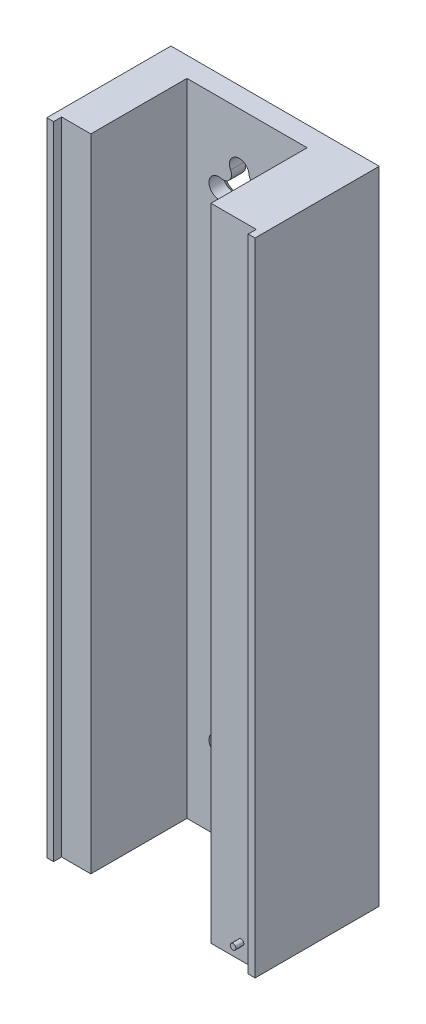
from build123d import *

# Parameters (mm, degrees)
PROFILE_EXTRUDE_DEPTH          = 80
SPROCKET_SKETCH_R              = 0.35
SPROCKET_EXTRUDE_DEPTH         = 1
MAGNET_CUT_DEPTH               = 85.817451035
MAGNET_CHAMFER_SIZE            = 0.75
MAGNET_CHAMFER_OF_MIRROR2_SIZE = 0.75


with BuildPart() as part:
    # Profile Sketch → Profile Extrude (new body)
    with BuildSketch(Plane(origin=(0.045617437, 0, -0.024209872), x_dir=(-1, 0, 0), z_dir=(0, 1, 0))):
        Polygon((5.545617437, -11.975790128), (5.545617437, 0.024209872), (-0.104382563, 0.024209872), (-0.104382563, 1.024209872), (-0.954382563, 1.024209872), (-0.954382563, -14.475790128), (25.045617437, -14.475790128), (25.045617437, 1.024209872), (24.195617437, 1.024209872), (24.195617437, 0.024209872), (20.545617437, 0.024209872), (20.545617437, -11.975790128), align=None)
    extrude(amount=PROFILE_EXTRUDE_DEPTH)

    # Sprocket Sketch → Sprocket Extrude (add)
    with BuildSketch(Plane.XY):
        with Locations((-1.75, 2)):
            Circle(SPROCKET_SKETCH_R)
    extrude(amount=SPROCKET_EXTRUDE_DEPTH)

    # Magnet Hole Sketch → Magnet Cut (cut, through all)
    with BuildSketch(Plane.XY.offset(-12)):
        with BuildLine():
            ThreePointArc((-11.151039281, 12.971757773), (-12.244559557, 12.644203044), (-13, 13.5))
            ThreePointArc((-13, 13.5), (-14.628920776, 14.461963369), (-15.254949311, 12.676789795))
            ThreePointArc((-15.254949311, 12.676789795), (-15.2813426, 11.535570233), (-16.328697807, 11.08155948))
            ThreePointArc((-16.328697807, 11.08155948), (-17.74694354, 9.829626791), (-16.242596036, 8.682589301))
            ThreePointArc((-16.242596036, 8.682589301), (-15.16538771, 8.304831552), (-15.057248383, 7.16844052))
            ThreePointArc((-15.057248383, 7.16844052), (-14.304851675, 5.432740197), (-12.749085251, 6.509005616))
            ThreePointArc((-12.749085251, 6.509005616), (-12.056940604, 7.41675805), (-10.942751617, 7.16844052))
            ThreePointArc((-10.942751617, 7.16844052), (-9.059499145, 7.347651415), (-9.602330121, 9.159857515))
            ThreePointArc((-9.602330121, 9.159857515), (-10.25176953, 10.098637121), (-9.671302193, 11.08155948))
            ThreePointArc((-9.671302193, 11.08155948), (-9.259784865, 12.928018228), (-11.151039281, 12.971757773))
        make_face()
    magnet_cut = extrude(amount=-MAGNET_CUT_DEPTH, mode=Mode.SUBTRACT)

    # Magnet Chamfer
    magnet_chamfer_edges = [part.edges().sort_by_distance(p)[0] for p in [
        (-14.628920776, 14.461963369, -14.5),
        (-15.2813426, 11.535570233, -14.5),
        (-12.244559557, 12.644203044, -14.5),
        (-17.74694354, 9.829626791, -14.5),
        (-9.259784865, 12.928018228, -14.5),
        (-15.16538771, 8.304831552, -14.5),
        (-10.25176953, 10.098637121, -14.5),
        (-14.304851675, 5.432740197, -14.5),
        (-9.059499145, 7.347651415, -14.5),
        (-12.056940604, 7.41675805, -14.5),
    ]]
    chamfer(magnet_chamfer_edges, length=MAGNET_CHAMFER_SIZE)

    # Mirror2: Magnet Cut across plane
    add(magnet_cut.mirror(Plane(origin=(0, 40, 0), x_dir=(0, 0, 1), z_dir=(0, -1, 0))), mode=Mode.SUBTRACT)

    # Magnet Chamfer of Mirror2
    magnet_chamfer_of_mirror2_edges = [part.edges().sort_by_distance(p)[0] for p in [
        (-14.628920776, 65.538036631, -14.5),
        (-15.2813426, 68.464429767, -14.5),
        (-12.244559557, 67.355796956, -14.5),
        (-17.74694354, 70.170373209, -14.5),
        (-9.259784865, 67.071981772, -14.5),
        (-15.16538771, 71.695168448, -14.5),
        (-10.25176953, 69.901362879, -14.5),
        (-14.304851675, 74.567259803, -14.5),
        (-9.059499145, 72.652348585, -14.5),
        (-12.056940604, 72.58324195, -14.5),
    ]]
    chamfer(magnet_chamfer_of_mirror2_edges, length=MAGNET_CHAMFER_OF_MIRROR2_SIZE)


solid = part.part
